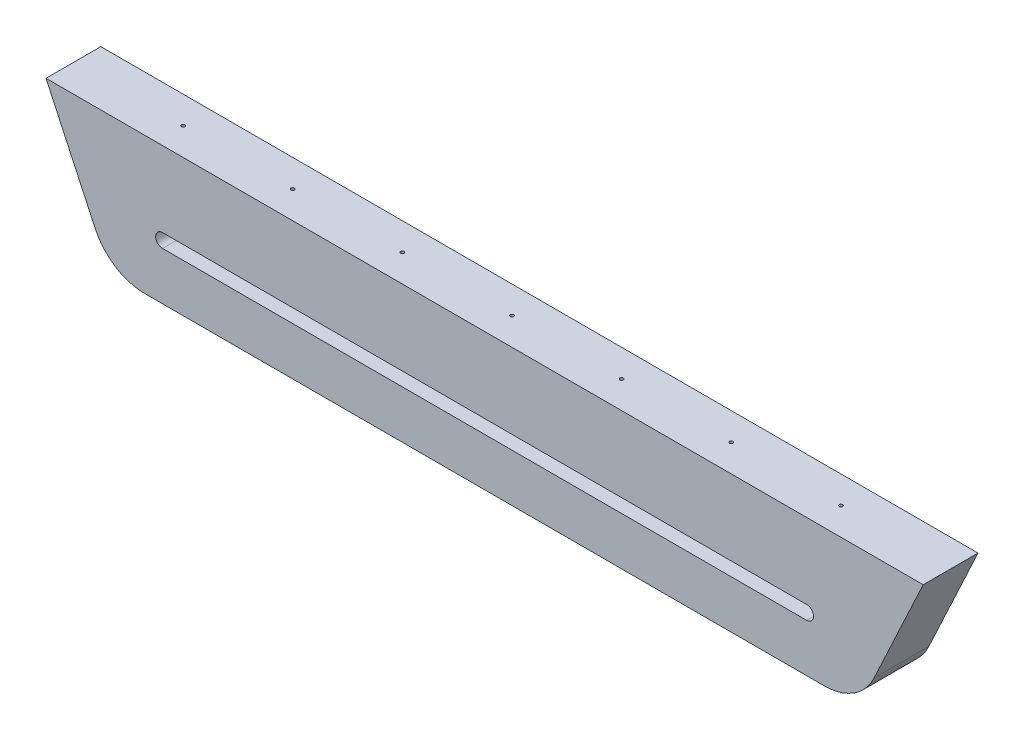
from build123d import *

# Parameters (mm, degrees)
BOSS_EXTRUDE1_DEPTH                = 25.4
FILLET1_R                          = 25.4
F_1_4_0_25_DIAMETER_SLOT1_DEPTH    = 25.4
F_1_16_0_0625_DIAMETER_HOLE1_D     = 1.5875
F_1_16_0_0625_DIAMETER_HOLE1_DEPTH = 12.7
F_1_16_0_0625_DIAMETER_HOLE1_TIP   = 0.476933116


# Read off the part's stored shape, not the designer's step: 1/4 (0.25) Diameter Slot1
with BuildPart() as part:
    # Sketch1 → Boss-Extrude1 (new body)
    with BuildSketch(Plane.XY):
        Polygon((-203.2, 0), (203.2, 0), (173.589463707, -63.5), (-173.589463707, -63.5), align=None)
    extrude(amount=BOSS_EXTRUDE1_DEPTH)

    # Fillet1
    fillet1_edges = [part.edges().sort_by_distance(p)[0] for p in [
        (173.589463707, -63.5, 12.7),
        (-173.589463707, -63.5, 12.7),
    ]]
    fillet(fillet1_edges, radius=FILLET1_R)

    # 1/4 (0.25) Diameter Slot1 outline → 1/4 (0.25) Diameter Slot1 (cut)
    with BuildSketch(Plane.XY):
        with BuildLine():
            Line((-149.225, -41.275), (149.225, -41.275))
            ThreePointArc((149.225, -41.275), (152.4, -38.1), (149.225, -34.925))
            Line((149.225, -34.925), (-149.225, -34.925))
            ThreePointArc((-149.225, -34.925), (-152.4, -38.1), (-149.225, -41.275))
        make_face()
    extrude(amount=F_1_4_0_25_DIAMETER_SLOT1_DEPTH, mode=Mode.SUBTRACT)

    # 1/16 (0.0625) Diameter Hole1
    with Locations(Plane(origin=(0, 0, 0), x_dir=(1, 0, 0), z_dir=(0, 1, 0))):
        with Locations((-152.4, -12.7), (-101.6, -12.7), (-50.8, -12.7), (0, -12.7), (50.8, -12.7), (101.6, -12.7), (152.4, -12.7)):
            Hole(F_1_16_0_0625_DIAMETER_HOLE1_D / 2, depth=F_1_16_0_0625_DIAMETER_HOLE1_DEPTH)
            with Locations((0, 0, -(F_1_16_0_0625_DIAMETER_HOLE1_DEPTH + F_1_16_0_0625_DIAMETER_HOLE1_TIP / 2))):  # 118° drill point
                Cone(0, F_1_16_0_0625_DIAMETER_HOLE1_D / 2, F_1_16_0_0625_DIAMETER_HOLE1_TIP, mode=Mode.SUBTRACT)


solid = part.part
